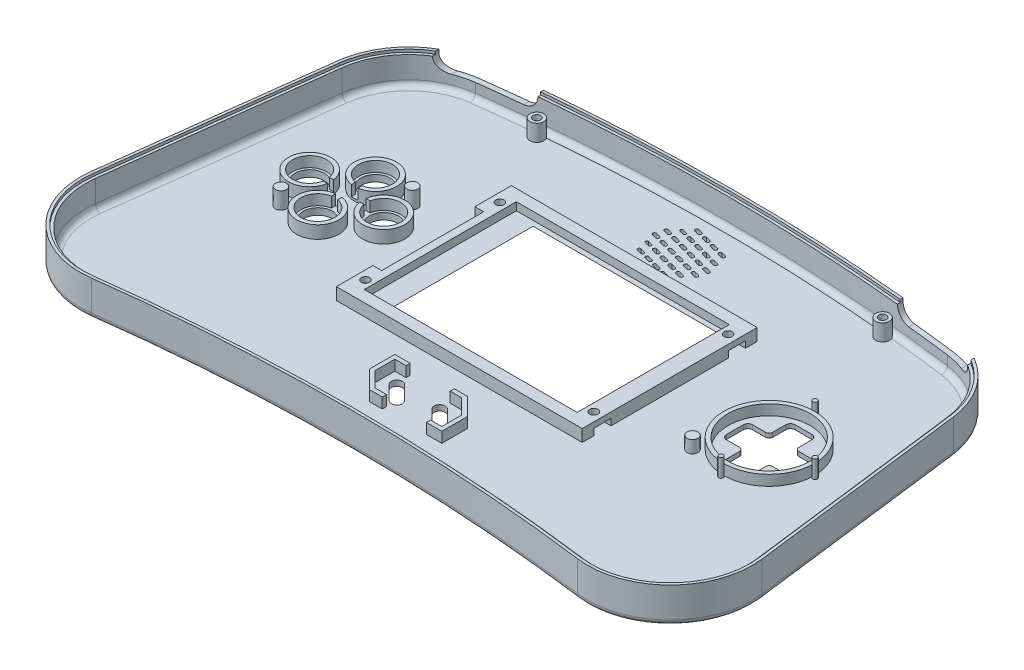
from build123d import *

# Parameters (mm, degrees)
FOND_COQUE_DEPTH                  = 2
CONTOUR_COQUE_DEPTH               = 10
CONG_1_R                          = 2
CONG_2_R                          = 2
ESQUISSE_CAVIT_CROU_W             = 67.82
ESQUISSE_CAVIT_CROU_H             = 51.74
CAVIT_CRAN_DEPTH                  = 3.55
ESQUISSE_GLISSI_RES_CRAN_W        = 67.82
ESQUISSE_GLISSI_RES_CRAN_H        = 51.74
GLISSI_RES_CRAN_DEPTH             = 1.55
CHANFREIN_CRAN_SIZE               = 3.55
ESQUISSE_SUR_L_VATION_CRAN_W      = 77.56
ESQUISSE_SUR_L_VATION_CRAN_H      = 55.4
SUR_L_VATION_CRAN_DEPTH           = 0.8
ESQUISSE_SUPPORT_CRAN_R           = 1.5
ESQUISSE_SUPPORT_CRAN_W           = 77.56
ESQUISSE_SUPPORT_CRAN_H           = 55.4
SUPPORT_CRAN_DEPTH                = 2.05
ESQUISSE_CAVIT_S_ABXY_R           = 5.3
CAVIT_S_ABXY_DEPTH                = 2.05
ESQUISSE_ABAISSEMENT_ABXY_R       = 5.3
ENL_V_MAT_EXTRU_4_DEPTH           = 0.4
ESQUISSE_SUPPORT_ABXY_R           = 7.7
ESQUISSE_SUPPORT_ABXY_R_2         = 6.2
SUPPORT_ABXY_DEPTH                = 4.6
BLOQUAGE_ABXY_DEPTH               = 4.6
ESQUISSE_FIXATION_MEMBRANE_ABXY_R = 2
FIXATION_MEMBRANE_ABXY_DEPTH      = 6.1
ESQUISSE37_R                      = 7.7
ESQUISSE37_R_2                    = 5.3
BOSS_EXTRU_4_DEPTH                = 0.8
CAVIT_DPAD_DEPTH                  = 2.05
ESQUISSE_SUPPORT_DPAD_R           = 16.5
ESQUISSE_SUPPORT_DPAD_R_2         = 15
SUPPORT_DPAD_DEPTH                = 3.8
ESQUISSE19_R                      = 16
ABAISSEMENT_DPAD_DEPTH            = 0.4
ESQUISSE25_R                      = 2
FIXATION_MEMBRANE_DPAD_DEPTH      = 4.5
ESQUISSE26_R                      = 0.825
BLOQUAGE_MEMBRANE_DPAD_DEPTH      = 6.5
BLOQUAGE_MEMBRANE_DPAD_2_DEPTH    = 6.5
BLOQUAGE_MEMBRANE_DPAD_3_DEPTH    = 6.5
BOSS_EXTRU_1_DEPTH                = 3.8
ENL_V_MAT_EXTRU_1_DEPTH           = 2
ENL_V_MAT_EXTRU_2_DEPTH           = 12.5
ESQUISSE31_R                      = 2.5
ESQUISSE31_R_2                    = 1.4
BOSS_EXTRU_2_DEPTH                = 6.04
ENL_V_MAT_EXTRU_3_DEPTH           = 2
BOSS_EXTRU_3_DEPTH                = 1


with BuildPart() as part:
    # Esquisse fond coque → Fond coque (new body)
    with BuildSketch(Plane(origin=(0, 0, 0), x_dir=(1, 0, 0), z_dir=(0, 1, 0))):
        with BuildLine():
            Line((-122.267092617, -38.917464466), (-112.267092617, 40.866153364))
            ThreePointArc((-112.267092617, 40.866153364), (-103.730176239, 58.331392363), (-86.278625954, 66.896257055))
            ThreePointArc((-86.278625954, 66.896257055), (0, 72.351557493), (86.278625954, 66.896257055))
            ThreePointArc((86.278625954, 66.896257055), (103.730176239, 58.331392363), (112.267092617, 40.866153364))
            Line((112.267092617, 40.866153364), (122.267092617, -38.917464466))
            ThreePointArc((122.267092617, -38.917464466), (113.659620701, -63.915093672), (88.618881119, -72.396331781))
            ThreePointArc((88.618881119, -72.396331781), (0, -66.639803527), (-88.618881119, -72.396331781))
            ThreePointArc((-88.618881119, -72.396331781), (-113.659620701, -63.915093672), (-122.267092617, -38.917464466))
        make_face()
    extrude(amount=FOND_COQUE_DEPTH)

    # Esquisse contour coque → Contour coque (add)
    with BuildSketch(Plane(origin=(0, 2, 0), x_dir=(1, 0, 0), z_dir=(0, 1, 0))):
        with BuildLine():
            Line((-122.267092617, -38.917464466), (-112.267092617, 40.866153364))
            ThreePointArc((-112.267092617, 40.866153364), (-103.730176239, 58.331392363), (-86.278625954, 66.896257055))
            ThreePointArc((-86.278625954, 66.896257055), (0, 72.351557493), (86.278625954, 66.896257055))
            ThreePointArc((86.278625954, 66.896257055), (103.730176239, 58.331392363), (112.267092617, 40.866153364))
            Line((112.267092617, 40.866153364), (122.267092617, -38.917464466))
            ThreePointArc((122.267092617, -38.917464466), (113.659620701, -63.915093672), (88.618881119, -72.396331781))
            ThreePointArc((88.618881119, -72.396331781), (0, -66.639803527), (-88.618881119, -72.396331781))
            ThreePointArc((-88.618881119, -72.396331781), (-113.659620701, -63.915093672), (-122.267092617, -38.917464466))
        make_face()
        with BuildLine():
            Line((-120.282619776, -39.166196336), (-110.282619776, 40.617421494))
            ThreePointArc((-110.282619776, 40.617421494), (-102.314831157, 56.918311227), (-86.026717557, 64.91218494))
            ThreePointArc((-86.026717557, 64.91218494), (0, 70.351557493), (86.026717557, 64.91218494))
            ThreePointArc((86.026717557, 64.91218494), (102.314831157, 56.918311227), (110.282619776, 40.617421494))
            Line((110.282619776, 40.617421494), (120.282619776, -39.166196336))
            ThreePointArc((120.282619776, -39.166196336), (112.248979321, -62.497316928), (88.877622378, -70.413139163))
            ThreePointArc((88.877622378, -70.413139163), (0, -64.639803527), (-88.877622378, -70.413139163))
            ThreePointArc((-88.877622378, -70.413139163), (-112.248979321, -62.497316928), (-120.282619776, -39.166196336))
        make_face(mode=Mode.SUBTRACT)
    extrude(amount=CONTOUR_COQUE_DEPTH)

    # Congé1
    cong_1_edges = [part.edges().sort_by_distance(p)[0] for p in [
        (-115.282619776, 2, -0.725612579),
        (-112.248979321, 2, 62.497316928),
        (0, 2, 64.639803527),
        (112.248979321, 2, 62.497316928),
        (115.282619776, 2, -0.725612579),
        (102.314831157, 2, -56.918311227),
        (0, 2, -70.351557493),
        (-102.314831157, 2, -56.918311227),
    ]]
    fillet(cong_1_edges, radius=CONG_1_R)

    # Congé2
    cong_2_edges = [part.edges().sort_by_distance(p)[0] for p in [
        (0, 0, 66.639803527),
        (-113.659620701, 0, 63.915093672),
        (-117.267092617, 0, -0.974344449),
        (-103.730176239, 0, -58.331392363),
        (0, 0, -72.351557493),
        (103.730176239, 0, -58.331392363),
        (117.267092617, 0, -0.974344449),
        (113.659620701, 0, 63.915093672),
    ]]
    fillet(cong_2_edges, radius=CONG_2_R)

    # Esquisse cavité écrou → Cavité écran (cut)
    with BuildSketch(Plane.XZ):
        with Locations((0, -8)):
            Rectangle(ESQUISSE_CAVIT_CROU_W, ESQUISSE_CAVIT_CROU_H)
    extrude(amount=-CAVIT_CRAN_DEPTH, mode=Mode.SUBTRACT)

    # Esquisse glissières écran → Glissières écran (add)
    with BuildSketch(Plane(origin=(0, 2, 0), x_dir=(1, 0, 0), z_dir=(0, 1, 0))):
        Polygon((-47.84, -23.87), (41.72, -23.87), (41.72, -19.58), (38.52, -19.58), (35.835321248, -18.03), (35.835321248, -14.93), (38.52, -13.38), (41.72, -13.38), (41.72, 29.38), (38.52, 29.38), (35.835321248, 30.93), (35.835321248, 34.03), (38.52, 35.58), (41.72, 35.58), (41.72, 39.87), (-47.84, 39.87), (-47.84, 35.58), (-44.64, 35.58), (-41.955321248, 34.03), (-41.955321248, 30.93), (-44.64, 29.38), (-47.84, 29.38), (-47.84, 26.555), (-44.64, 26.555), (-44.64, -10.555), (-47.84, -10.555), (-47.84, -13.38), (-44.64, -13.38), (-41.955321248, -14.93), (-41.955321248, -18.03), (-44.64, -19.58), (-47.84, -19.58), align=None)
        with Locations((0, 8)):
            Rectangle(ESQUISSE_GLISSI_RES_CRAN_W, ESQUISSE_GLISSI_RES_CRAN_H, mode=Mode.SUBTRACT)
    extrude(amount=GLISSI_RES_CRAN_DEPTH)

    # Chanfrein écran
    chanfrein_cran_edges = [part.edges().sort_by_distance(p)[0] for p in [
        (33.91, 0, -8),
        (0, 0, 17.87),
        (-33.91, 0, -8),
        (0, 0, -33.87),
    ]]
    chamfer(chanfrein_cran_edges, length=CHANFREIN_CRAN_SIZE - 0.0001)  # a hair under: the kernel refuses the full size

    # Esquisse surélévation écran → Surélévation écran (add)
    with BuildSketch(Plane(origin=(0, 3.55, 0), x_dir=(1, 0, 0), z_dir=(0, 1, 0))):
        Polygon((-47.84, 39.87), (-47.84, 35.58), (-44.64, 35.58), (-41.955321248, 34.03), (-41.955321248, 30.93), (-44.64, 29.38), (-47.84, 29.38), (-47.84, 26.555), (-44.64, 26.555), (-44.64, -10.555), (-47.84, -10.555), (-47.84, -13.38), (-44.64, -13.38), (-41.955321248, -14.93), (-41.955321248, -18.03), (-44.64, -19.58), (-47.84, -19.58), (-47.84, -23.87), (41.72, -23.87), (41.72, -19.58), (38.52, -19.58), (35.835321248, -18.03), (35.835321248, -14.93), (38.52, -13.38), (41.72, -13.38), (41.72, 29.38), (38.52, 29.38), (35.835321248, 30.93), (35.835321248, 34.03), (38.52, 35.58), (41.72, 35.58), (41.72, 39.87), align=None)
        with Locations((-3.06, 8)):
            Rectangle(ESQUISSE_SUR_L_VATION_CRAN_W, ESQUISSE_SUR_L_VATION_CRAN_H, mode=Mode.SUBTRACT)
    extrude(amount=SUR_L_VATION_CRAN_DEPTH)

    # Esquisse support écran → Support écran (add)
    with BuildSketch(Plane(origin=(0, 4.35, 0), x_dir=(1, 0, 0), z_dir=(0, 1, 0))):
        Polygon((-47.84, -10.555), (-47.84, -23.87), (41.72, -23.87), (41.72, 39.87), (-47.84, 39.87), (-47.84, 26.555), (-44.64, 26.555), (-44.64, -10.555), align=None)
        with Locations(Location((-44.64, 32.48, 0), (0, 0, 270))):
            Circle(ESQUISSE_SUPPORT_CRAN_R, mode=Mode.SUBTRACT)
        with Locations(Location((-44.64, -16.48, 0), (0, 0, 270))):
            Circle(ESQUISSE_SUPPORT_CRAN_R, mode=Mode.SUBTRACT)
        with Locations(Location((38.52, -16.48, 0), (0, 0, 270))):
            Circle(ESQUISSE_SUPPORT_CRAN_R, mode=Mode.SUBTRACT)
        with Locations(Location((38.52, 32.48, 0), (0, 0, 270))):
            Circle(ESQUISSE_SUPPORT_CRAN_R, mode=Mode.SUBTRACT)
        with Locations((-3.06, 8)):
            Rectangle(ESQUISSE_SUPPORT_CRAN_W, ESQUISSE_SUPPORT_CRAN_H, mode=Mode.SUBTRACT)
    extrude(amount=SUPPORT_CRAN_DEPTH)

    # Esquisse cavités ABXY → Cavités ABXY (cut)
    with BuildSketch(Plane.XZ):
        with Locations(Location((-75.96, -18.5, 0), (0, 0, 270))):
            Circle(ESQUISSE_CAVIT_S_ABXY_R)
        with Locations(Location((-75.96, 2.5, 0), (0, 0, 270))):
            Circle(ESQUISSE_CAVIT_S_ABXY_R)
        with Locations(Location((-62.46, -8, 0), (0, 0, 270))):
            Circle(ESQUISSE_CAVIT_S_ABXY_R)
        with Locations(Location((-89.46, -8, 0), (0, 0, 270))):
            Circle(ESQUISSE_CAVIT_S_ABXY_R)
    extrude(amount=-CAVIT_S_ABXY_DEPTH, mode=Mode.SUBTRACT)

    # Esquisse abaissement ABXY → Enlèv. mat.-Extru.4 (cut)
    # profile 1 of 2: a face of its own
    with BuildSketch(Plane(origin=(0, 0, 0), x_dir=(-1, 0, 0), z_dir=(0, -1, 0))):
        with BuildLine():
            Line((79.910107836, 13.337705802), (66.49112014, 2.900715372))
            ThreePointArc((66.49112014, 2.900715372), (57.369716739, 4.040890797), (58.509892164, 13.162294198))
            Line((58.509892164, 13.162294198), (71.92887986, 23.599284628))
            ThreePointArc((71.92887986, 23.599284628), (81.050283261, 22.459109203), (79.910107836, 13.337705802))
        make_face()
        with Locations(Location((62.46, 8, 0), (0, 0, 90))):
            Circle(ESQUISSE_ABAISSEMENT_ABXY_R, mode=Mode.SUBTRACT)
        with Locations(Location((75.96, 18.5, 0), (0, 0, 90))):
            Circle(ESQUISSE_ABAISSEMENT_ABXY_R, mode=Mode.SUBTRACT)
    # profile 2 of 2: a face of its own
    with BuildSketch(Plane(origin=(0, 0, 0), x_dir=(-1, 0, 0), z_dir=(0, -1, 0))):
        with BuildLine():
            Line((72.009892164, 2.662294198), (85.42887986, 13.099284628))
            ThreePointArc((85.42887986, 13.099284628), (94.550283261, 11.959109203), (93.410107836, 2.837705802))
            Line((93.410107836, 2.837705802), (79.99112014, -7.599284628))
            ThreePointArc((79.99112014, -7.599284628), (70.869716739, -6.459109203), (72.009892164, 2.662294198))
        make_face()
        with Locations(Location((75.96, -2.5, 0), (0, 0, 90))):
            Circle(ESQUISSE_ABAISSEMENT_ABXY_R, mode=Mode.SUBTRACT)
        with Locations(Location((89.46, 8, 0), (0, 0, 90))):
            Circle(ESQUISSE_ABAISSEMENT_ABXY_R, mode=Mode.SUBTRACT)
    extrude(amount=-ENL_V_MAT_EXTRU_4_DEPTH, mode=Mode.SUBTRACT)

    # Esquisse support ABXY → Support ABXY (add)
    # profile 1 of 4: a face of its own
    with BuildSketch(Plane(origin=(0, 2, 0), x_dir=(1, 0, 0), z_dir=(0, 1, 0))):
        with Locations(Location((-75.96, 18.5, 0), (0, 0, 270))):
            Circle(ESQUISSE_SUPPORT_ABXY_R)
        with Locations(Location((-75.96, 18.5, 0), (0, 0, 270))):
            Circle(ESQUISSE_SUPPORT_ABXY_R_2, mode=Mode.SUBTRACT)
    # profile 2 of 4: a face of its own
    with BuildSketch(Plane(origin=(0, 2, 0), x_dir=(1, 0, 0), z_dir=(0, 1, 0))):
        with Locations(Location((-89.46, 8, 0), (0, 0, 270))):
            Circle(ESQUISSE_SUPPORT_ABXY_R)
        with Locations(Location((-89.46, 8, 0), (0, 0, 270))):
            Circle(ESQUISSE_SUPPORT_ABXY_R_2, mode=Mode.SUBTRACT)
    # profile 3 of 4: a face of its own
    with BuildSketch(Plane(origin=(0, 2, 0), x_dir=(1, 0, 0), z_dir=(0, 1, 0))):
        with Locations(Location((-75.96, -2.5, 0), (0, 0, 270))):
            Circle(ESQUISSE_SUPPORT_ABXY_R)
        with Locations(Location((-75.96, -2.5, 0), (0, 0, 270))):
            Circle(ESQUISSE_SUPPORT_ABXY_R_2, mode=Mode.SUBTRACT)
    # profile 4 of 4: a face of its own
    with BuildSketch(Plane(origin=(0, 2, 0), x_dir=(1, 0, 0), z_dir=(0, 1, 0))):
        with Locations(Location((-62.46, 8, 0), (0, 0, 270))):
            Circle(ESQUISSE_SUPPORT_ABXY_R)
        with Locations(Location((-62.46, 8, 0), (0, 0, 270))):
            Circle(ESQUISSE_SUPPORT_ABXY_R_2, mode=Mode.SUBTRACT)
    extrude(amount=SUPPORT_ABXY_DEPTH)

    # Esquisse bloquage ABXY → Bloquage ABXY (cut)
    with BuildSketch(Plane(origin=(0, 2, 0), x_dir=(1, 0, 0), z_dir=(0, 1, 0))):
        Polygon((-74.81, 3), (-77.11, 3), (-77.11, 6.85), (-83.96, 6.85), (-83.96, 9.15), (-77.11, 9.15), (-77.11, 13), (-74.81, 13), (-74.81, 9.15), (-67.96, 9.15), (-67.96, 6.85), (-74.81, 6.85), align=None)
    extrude(amount=BLOQUAGE_ABXY_DEPTH, mode=Mode.SUBTRACT)

    # Esquisse fixation membrane ABXY → Fixation membrane ABXY (add)
    with BuildSketch(Plane(origin=(0, 2, 0), x_dir=(1, 0, 0), z_dir=(0, 1, 0))):
        with Locations(Location((-87.849022885, -4.052815137, 0), (0, 0, 270))):
            Circle(ESQUISSE_FIXATION_MEMBRANE_ABXY_R)
        with Locations(Location((-64.070977115, 20.052815137, 0), (0, 0, 270))):
            Circle(ESQUISSE_FIXATION_MEMBRANE_ABXY_R)
    extrude(amount=FIXATION_MEMBRANE_ABXY_DEPTH)

    # Esquisse37 → Boss.-Extru.4 (add)
    # profile 1 of 4: a face of its own
    with BuildSketch(Plane(origin=(0, 2, 0), x_dir=(1, 0, 0), z_dir=(0, 1, 0))):
        with Locations(Location((-89.46, 8, 0), (0, 0, 8.589297624))):
            Circle(ESQUISSE37_R)
        with Locations(Location((-89.46, 8, 0), (0, 0, 90))):
            Circle(ESQUISSE37_R_2, mode=Mode.SUBTRACT)
    # profile 2 of 4: a face of its own
    with BuildSketch(Plane(origin=(0, 2, 0), x_dir=(1, 0, 0), z_dir=(0, 1, 0))):
        with Locations(Location((-75.96, 18.5, 0), (0, 0, 261.410702376))):
            Circle(ESQUISSE37_R)
        with Locations(Location((-75.96, 18.5, 0), (0, 0, 90))):
            Circle(ESQUISSE37_R_2, mode=Mode.SUBTRACT)
    # profile 3 of 4: a face of its own
    with BuildSketch(Plane(origin=(0, 2, 0), x_dir=(1, 0, 0), z_dir=(0, 1, 0))):
        with Locations(Location((-62.46, 8, 0), (0, 0, 171.410702376))):
            Circle(ESQUISSE37_R)
        with Locations(Location((-62.46, 8, 0), (0, 0, 90))):
            Circle(ESQUISSE37_R_2, mode=Mode.SUBTRACT)
    # profile 4 of 4: a face of its own
    with BuildSketch(Plane(origin=(0, 2, 0), x_dir=(1, 0, 0), z_dir=(0, 1, 0))):
        with Locations(Location((-75.96, -2.5, 0), (0, 0, 81.410702376))):
            Circle(ESQUISSE37_R)
        with Locations(Location((-75.96, -2.5, 0), (0, 0, 90))):
            Circle(ESQUISSE37_R_2, mode=Mode.SUBTRACT)
    extrude(amount=BOSS_EXTRU_4_DEPTH)

    # Esquisse cavité DPad → Cavité DPad (cut)
    with BuildSketch(Plane.XZ):
        with BuildLine():
            Line((82.71, -14.035533906), (82.71, -18.815863992))
            ThreePointArc((82.71, -18.815863992), (82.216727984, -20.006727984), (81.025863992, -20.5))
            Line((81.025863992, -20.5), (74.894136008, -20.5))
            ThreePointArc((74.894136008, -20.5), (73.703272016, -20.006727984), (73.21, -18.815863992))
            Line((73.21, -18.815863992), (73.21, -14.035533906))
            ThreePointArc((73.21, -14.035533906), (72.833475836, -13.126524164), (71.924466094, -12.75))
            Line((71.924466094, -12.75), (67.144136008, -12.75))
            ThreePointArc((67.144136008, -12.75), (65.953272016, -12.256727984), (65.46, -11.065863992))
            Line((65.46, -11.065863992), (65.46, -4.934136008))
            ThreePointArc((65.46, -4.934136008), (65.953272016, -3.743272016), (67.144136008, -3.25))
            Line((67.144136008, -3.25), (71.924466094, -3.25))
            ThreePointArc((71.924466094, -3.25), (72.833475836, -2.873475836), (73.21, -1.964466094))
            Line((73.21, -1.964466094), (73.21, 2.815863992))
            ThreePointArc((73.21, 2.815863992), (73.703272016, 4.006727984), (74.894136008, 4.5))
            Line((74.894136008, 4.5), (81.025863992, 4.5))
            ThreePointArc((81.025863992, 4.5), (82.216727984, 4.006727984), (82.71, 2.815863992))
            Line((82.71, 2.815863992), (82.71, -1.964466094))
            ThreePointArc((82.71, -1.964466094), (83.086524164, -2.873475836), (83.995533906, -3.25))
            Line((83.995533906, -3.25), (88.775863992, -3.25))
            ThreePointArc((88.775863992, -3.25), (89.966727984, -3.743272016), (90.46, -4.934136008))
            Line((90.46, -4.934136008), (90.46, -11.065863992))
            ThreePointArc((90.46, -11.065863992), (89.966727984, -12.256727984), (88.775863992, -12.75))
            Line((88.775863992, -12.75), (83.995533906, -12.75))
            ThreePointArc((83.995533906, -12.75), (83.086524164, -13.126524164), (82.71, -14.035533906))
        make_face()
    extrude(amount=-CAVIT_DPAD_DEPTH, mode=Mode.SUBTRACT)

    # Esquisse support DPad → Support DPad (add)
    with BuildSketch(Plane(origin=(0, 2, 0), x_dir=(1, 0, 0), z_dir=(0, 1, 0))):
        with Locations(Location((77.96, 8, 0), (0, 0, 90))):
            Circle(ESQUISSE_SUPPORT_DPAD_R)
        with Locations(Location((77.96, 8, 0), (0, 0, 90))):
            Circle(ESQUISSE_SUPPORT_DPAD_R_2, mode=Mode.SUBTRACT)
    extrude(amount=SUPPORT_DPAD_DEPTH)

    # Esquisse19 → Abaissement DPad (cut)
    with BuildSketch(Plane.XZ):
        with Locations(Location((77.96, -8, 0), (0, 0, 270))):
            Circle(ESQUISSE19_R)
    extrude(amount=-ABAISSEMENT_DPAD_DEPTH, mode=Mode.SUBTRACT)

    # Esquisse25 → Fixation membrane DPad (add)
    with BuildSketch(Plane(origin=(0, 2, 0), x_dir=(1, 0, 0), z_dir=(0, 1, 0))):
        with Locations(Location((63.994641072, -5.965358928, 0), (0, 0, 270))):
            Circle(ESQUISSE25_R)
    extrude(amount=FIXATION_MEMBRANE_DPAD_DEPTH)

    # Esquisse27 → Boss.-Extru.1 (add)
    with BuildSketch(Plane(origin=(0, 2, 0), x_dir=(1, 0, 0), z_dir=(0, 1, 0))):
        Polygon((-10.8, -34.02), (-10.8, -35.52), (-14.9, -35.52), (-14.9, -42.704567107), (-9.384567107, -48.22), (-5.284567107, -48.22), (-5.284567107, -49.72), (-10.00588745, -49.72), (-16.4, -43.32588745), (-16.4, -34.02), align=None)
        Polygon((5.284567107, -34.02), (5.284567107, -35.52), (9.384567107, -35.52), (14.9, -41.035432893), (14.9, -48.22), (10.8, -48.22), (10.8, -49.72), (16.4, -49.72), (16.4, -40.41411255), (10.00588745, -34.02), align=None)
    extrude(amount=BOSS_EXTRU_1_DEPTH)

    # Esquisse28 → Enlèv. mat.-Extru.1 (cut)
    with BuildSketch(Plane(origin=(0, 2, 0), x_dir=(1, 0, 0), z_dir=(0, 1, 0))):
        with BuildLine():
            Line((-8.92137085, -37.910202025), (-3.830202025, -43.00137085))
            ThreePointArc((-3.830202025, -43.00137085), (-3.830202025, -45.829797975), (-6.65862915, -45.829797975))
            Line((-6.65862915, -45.829797975), (-11.749797975, -40.73862915))
            ThreePointArc((-11.749797975, -40.73862915), (-11.749797975, -37.910202025), (-8.92137085, -37.910202025))
        make_face()
        with BuildLine():
            Line((6.65862915, -37.910202025), (11.749797975, -43.00137085))
            ThreePointArc((11.749797975, -43.00137085), (11.749797975, -45.829797975), (8.92137085, -45.829797975))
            Line((8.92137085, -45.829797975), (3.830202025, -40.73862915))
            ThreePointArc((3.830202025, -40.73862915), (3.830202025, -37.910202025), (6.65862915, -37.910202025))
        make_face()
    extrude(amount=-ENL_V_MAT_EXTRU_1_DEPTH, mode=Mode.SUBTRACT)

    # Esquisse30 → Enlèv. mat.-Extru.2 (cut, symmetric)
    with BuildSketch(Plane(origin=(0, 0, -70.849932586), x_dir=(-1, 0, 0), z_dir=(0, 0, -1))):
        with BuildLine():
            Line((-92.85, 7.35), (-70.15, 7.35))
            ThreePointArc((-70.15, 7.35), (-66.861953467, 8.711953467), (-65.5, 12))
            Line((-65.5, 12), (-97.5, 12))
            ThreePointArc((-97.5, 12), (-96.138046533, 8.711953467), (-92.85, 7.35))
        make_face()
        with BuildLine():
            Line((97.5, 12), (65.5, 12))
            ThreePointArc((65.5, 12), (66.861953467, 8.711953467), (70.15, 7.35))
            Line((70.15, 7.35), (92.85, 7.35))
            ThreePointArc((92.85, 7.35), (96.138046533, 8.711953467), (97.5, 12))
        make_face()
    extrude(amount=ENL_V_MAT_EXTRU_2_DEPTH, both=True, mode=Mode.SUBTRACT)

    # Esquisse31 → Boss.-Extru.2 (add)
    # profile 1 of 2: a face of its own
    with BuildSketch(Plane(origin=(0, 2, 0), x_dir=(1, 0, 0), z_dir=(0, 1, 0))):
        with Locations(Location((-62.98, 64.303563447, 0), (0, 0, 31.955716634))):
            Circle(ESQUISSE31_R)
        with Locations(Location((-62.98, 64.303563447, 0), (0, 0, 58.728166447))):
            Circle(ESQUISSE31_R_2, mode=Mode.SUBTRACT)
    # profile 2 of 2: a face of its own
    with BuildSketch(Plane(origin=(0, 2, 0), x_dir=(1, 0, 0), z_dir=(0, 1, 0))):
        with Locations(Location((62.98, 64.303563447, 0), (0, 0, 148.04428335))):
            Circle(ESQUISSE31_R)
        with Locations(Location((62.98, 64.303563447, 0), (0, 0, 121.271833558))):
            Circle(ESQUISSE31_R_2, mode=Mode.SUBTRACT)
    extrude(amount=BOSS_EXTRU_2_DEPTH)

    # Esquisse34 → Enlèv. mat.-Extru.3 (cut)
    with BuildSketch(Plane.XZ):
        with BuildLine():
            Line((8.942036004, -61.018950214), (7.396554682, -61.433060687))
            ThreePointArc((7.396554682, -61.433060687), (6.661707759, -61.008796618), (7.085971828, -60.273949695))
            Line((7.085971828, -60.273949695), (8.63145315, -59.859839223))
            ThreePointArc((8.63145315, -59.859839223), (9.366300073, -60.284103292), (8.942036004, -61.018950214))
        make_face()
        with BuildLine():
            Line((5.078332699, -62.054226395), (3.532851377, -62.468336867))
            ThreePointArc((3.532851377, -62.468336867), (2.798004454, -62.044072798), (3.222268523, -61.309225875))
            Line((3.222268523, -61.309225875), (4.767749845, -60.895115403))
            ThreePointArc((4.767749845, -60.895115403), (5.502596767, -61.319379472), (5.078332699, -62.054226395))
        make_face()
        with BuildLine():
            Line((1.214629394, -63.089502575), (-0.330851929, -63.503613047))
            ThreePointArc((-0.330851929, -63.503613047), (-1.065698851, -63.079348979), (-0.641434783, -62.344502056))
            Line((-0.641434783, -62.344502056), (0.904046539, -61.930391584))
            ThreePointArc((0.904046539, -61.930391584), (1.638893462, -62.354655652), (1.214629394, -63.089502575))
        make_face()
        with BuildLine():
            Line((-2.649073912, -64.124778756), (-4.194555234, -64.538889228))
            ThreePointArc((-4.194555234, -64.538889228), (-4.929402157, -64.114625159), (-4.505138088, -63.379778236))
            Line((-4.505138088, -63.379778236), (-2.959656766, -62.965667764))
            ThreePointArc((-2.959656766, -62.965667764), (-2.224809843, -63.389931833), (-2.649073912, -64.124778756))
        make_face()
        with BuildLine():
            Line((9.986508073, -57.189566434), (8.441026751, -57.603676906))
            ThreePointArc((8.441026751, -57.603676906), (7.706179828, -57.179412838), (8.130443897, -56.444565915))
            Line((8.130443897, -56.444565915), (9.675925219, -56.030455443))
            ThreePointArc((9.675925219, -56.030455443), (10.410772142, -56.454719511), (9.986508073, -57.189566434))
        make_face()
        with BuildLine():
            Line((6.122804768, -58.224842614), (4.577323446, -58.638953087))
            ThreePointArc((4.577323446, -58.638953087), (3.842476523, -58.214689018), (4.266740592, -57.479842095))
            Line((4.266740592, -57.479842095), (5.812221914, -57.065731623))
            ThreePointArc((5.812221914, -57.065731623), (6.547068837, -57.489995692), (6.122804768, -58.224842614))
        make_face()
        with BuildLine():
            Line((2.259101463, -59.260118795), (0.713620141, -59.674229267))
            ThreePointArc((0.713620141, -59.674229267), (-0.021226782, -59.249965198), (0.403037287, -58.515118276))
            Line((0.403037287, -58.515118276), (1.948518609, -58.101007803))
            ThreePointArc((1.948518609, -58.101007803), (2.683365532, -58.525271872), (2.259101463, -59.260118795))
        make_face()
        with BuildLine():
            Line((-1.604601842, -60.295394975), (-3.150083164, -60.709505447))
            ThreePointArc((-3.150083164, -60.709505447), (-3.884930087, -60.285241379), (-3.460666018, -59.550394456))
            Line((-3.460666018, -59.550394456), (-1.915184696, -59.136283984))
            ThreePointArc((-1.915184696, -59.136283984), (-1.180337774, -59.560548052), (-1.604601842, -60.295394975))
        make_face()
        with BuildLine():
            Line((-5.397594469, -61.208196669), (-6.943075791, -61.622307141))
            ThreePointArc((-6.943075791, -61.622307141), (-7.555448227, -61.26875375), (-7.201894836, -60.656381314))
            Line((-7.201894836, -60.656381314), (-5.656413514, -60.242270842))
            ThreePointArc((-5.656413514, -60.242270842), (-5.044041079, -60.595824233), (-5.397594469, -61.208196669))
        make_face()
        with BuildLine():
            Line((11.030980143, -53.360182654), (9.485498821, -53.774293126))
            ThreePointArc((9.485498821, -53.774293126), (8.750651898, -53.350029057), (9.174915966, -52.615182134))
            Line((9.174915966, -52.615182134), (10.720397288, -52.201071662))
            ThreePointArc((10.720397288, -52.201071662), (11.455244211, -52.625335731), (11.030980143, -53.360182654))
        make_face()
        with BuildLine():
            Line((7.167276837, -54.395458834), (5.621795515, -54.809569306))
            ThreePointArc((5.621795515, -54.809569306), (4.886948593, -54.385305238), (5.311212661, -53.650458315))
            Line((5.311212661, -53.650458315), (6.856693983, -53.236347843))
            ThreePointArc((6.856693983, -53.236347843), (7.591540906, -53.660611911), (7.167276837, -54.395458834))
        make_face()
        with BuildLine():
            Line((3.303573532, -55.430735015), (1.75809221, -55.844845487))
            ThreePointArc((1.75809221, -55.844845487), (1.023245287, -55.420581418), (1.447509356, -54.685734495))
            Line((1.447509356, -54.685734495), (2.992990678, -54.271624023))
            ThreePointArc((2.992990678, -54.271624023), (3.727837601, -54.695888092), (3.303573532, -55.430735015))
        make_face()
        with BuildLine():
            Line((-0.560129773, -56.466011195), (-2.105611095, -56.880121667))
            ThreePointArc((-2.105611095, -56.880121667), (-2.840458018, -56.455857598), (-2.416193949, -55.721010676))
            Line((-2.416193949, -55.721010676), (-0.870712627, -55.306900203))
            ThreePointArc((-0.870712627, -55.306900203), (-0.135865704, -55.731164272), (-0.560129773, -56.466011195))
        make_face()
        with BuildLine():
            Line((-4.423833078, -57.501287375), (-5.9693144, -57.915397848))
            ThreePointArc((-5.9693144, -57.915397848), (-6.704161323, -57.491133779), (-6.279897254, -56.756286856))
            Line((-6.279897254, -56.756286856), (-4.734415932, -56.342176384))
            ThreePointArc((-4.734415932, -56.342176384), (-3.999569009, -56.766440453), (-4.423833078, -57.501287375))
        make_face()
        with BuildLine():
            Line((-8.287536383, -58.536563556), (-9.833017705, -58.950674028))
            ThreePointArc((-9.833017705, -58.950674028), (-10.567864628, -58.526409959), (-10.143600559, -57.791563036))
            Line((-10.143600559, -57.791563036), (-8.598119237, -57.377452564))
            ThreePointArc((-8.598119237, -57.377452564), (-7.863272314, -57.801716633), (-8.287536383, -58.536563556))
        make_face()
        with BuildLine():
            Line((10.143600559, -50.048436964), (8.598119237, -50.462547436))
            ThreePointArc((8.598119237, -50.462547436), (7.863272314, -50.038283367), (8.287536383, -49.303436444))
            Line((8.287536383, -49.303436444), (9.833017705, -48.889325972))
            ThreePointArc((9.833017705, -48.889325972), (10.567864628, -49.313590041), (10.143600559, -50.048436964))
        make_face()
        with BuildLine():
            Line((6.279897254, -51.083713144), (4.734415932, -51.497823616))
            ThreePointArc((4.734415932, -51.497823616), (3.999569009, -51.073559547), (4.423833078, -50.338712625))
            Line((4.423833078, -50.338712625), (5.9693144, -49.924602152))
            ThreePointArc((5.9693144, -49.924602152), (6.704161323, -50.348866221), (6.279897254, -51.083713144))
        make_face()
        with BuildLine():
            Line((2.416193949, -52.118989324), (0.870712627, -52.533099797))
            ThreePointArc((0.870712627, -52.533099797), (0.135865704, -52.108835728), (0.560129773, -51.373988805))
            Line((0.560129773, -51.373988805), (2.105611095, -50.959878333))
            ThreePointArc((2.105611095, -50.959878333), (2.840458018, -51.384142402), (2.416193949, -52.118989324))
        make_face()
        with BuildLine():
            Line((-1.447509356, -53.154265505), (-2.992990678, -53.568375977))
            ThreePointArc((-2.992990678, -53.568375977), (-3.727837601, -53.144111908), (-3.303573532, -52.409264985))
            Line((-3.303573532, -52.409264985), (-1.75809221, -51.995154513))
            ThreePointArc((-1.75809221, -51.995154513), (-1.023245287, -52.419418582), (-1.447509356, -53.154265505))
        make_face()
        with BuildLine():
            Line((-5.311212661, -54.189541685), (-6.856693983, -54.603652157))
            ThreePointArc((-6.856693983, -54.603652157), (-7.591540906, -54.179388089), (-7.167276837, -53.444541166))
            Line((-7.167276837, -53.444541166), (-5.621795515, -53.030430694))
            ThreePointArc((-5.621795515, -53.030430694), (-4.886948593, -53.454694762), (-5.311212661, -54.189541685))
        make_face()
        with BuildLine():
            Line((-9.174915966, -55.224817866), (-10.720397288, -55.638928338))
            ThreePointArc((-10.720397288, -55.638928338), (-11.455244211, -55.214664269), (-11.030980143, -54.479817346))
            Line((-11.030980143, -54.479817346), (-9.485498821, -54.065706874))
            ThreePointArc((-9.485498821, -54.065706874), (-8.750651898, -54.489970943), (-9.174915966, -55.224817866))
        make_face()
        with BuildLine():
            Line((7.324369324, -47.254329364), (5.778888002, -47.668439836))
            ThreePointArc((5.778888002, -47.668439836), (5.044041079, -47.244175767), (5.468305147, -46.509328844))
            Line((5.468305147, -46.509328844), (7.013786469, -46.095218372))
            ThreePointArc((7.013786469, -46.095218372), (7.748633392, -46.519482441), (7.324369324, -47.254329364))
        make_face()
        with BuildLine():
            Line((3.460666018, -48.289605544), (1.915184696, -48.703716016))
            ThreePointArc((1.915184696, -48.703716016), (1.180337774, -48.279451948), (1.604601842, -47.544605025))
            Line((1.604601842, -47.544605025), (3.150083164, -47.130494553))
            ThreePointArc((3.150083164, -47.130494553), (3.884930087, -47.554758621), (3.460666018, -48.289605544))
        make_face()
        with BuildLine():
            Line((-0.403037287, -49.324881724), (-1.948518609, -49.738992197))
            ThreePointArc((-1.948518609, -49.738992197), (-2.683365532, -49.314728128), (-2.259101463, -48.579881205))
            Line((-2.259101463, -48.579881205), (-0.713620141, -48.165770733))
            ThreePointArc((-0.713620141, -48.165770733), (0.021226782, -48.590034802), (-0.403037287, -49.324881724))
        make_face()
        with BuildLine():
            Line((-4.266740592, -50.360157905), (-5.812221914, -50.774268377))
            ThreePointArc((-5.812221914, -50.774268377), (-6.547068837, -50.350004308), (-6.122804768, -49.615157386))
            Line((-6.122804768, -49.615157386), (-4.577323446, -49.201046913))
            ThreePointArc((-4.577323446, -49.201046913), (-3.842476523, -49.625310982), (-4.266740592, -50.360157905))
        make_face()
        with BuildLine():
            Line((-8.059733219, -51.272959598), (-9.605214541, -51.68707007))
            ThreePointArc((-9.605214541, -51.68707007), (-10.217586977, -51.33351668), (-9.864033586, -50.721144244))
            Line((-9.864033586, -50.721144244), (-8.318552264, -50.307033772))
            ThreePointArc((-8.318552264, -50.307033772), (-7.706179828, -50.660587162), (-8.059733219, -51.272959598))
        make_face()
        with BuildLine():
            Line((4.505138088, -44.460221764), (2.959656766, -44.874332236))
            ThreePointArc((2.959656766, -44.874332236), (2.224809843, -44.450068167), (2.649073912, -43.715221244))
            Line((2.649073912, -43.715221244), (4.194555234, -43.301110772))
            ThreePointArc((4.194555234, -43.301110772), (4.929402157, -43.725374841), (4.505138088, -44.460221764))
        make_face()
        with BuildLine():
            Line((0.641434783, -45.495497944), (-0.904046539, -45.909608416))
            ThreePointArc((-0.904046539, -45.909608416), (-1.638893462, -45.485344348), (-1.214629394, -44.750497425))
            Line((-1.214629394, -44.750497425), (0.330851929, -44.336386953))
            ThreePointArc((0.330851929, -44.336386953), (1.065698851, -44.760651021), (0.641434783, -45.495497944))
        make_face()
        with BuildLine():
            Line((-3.222268523, -46.530774125), (-4.767749845, -46.944884597))
            ThreePointArc((-4.767749845, -46.944884597), (-5.502596767, -46.520620528), (-5.078332699, -45.785773605))
            Line((-5.078332699, -45.785773605), (-3.532851377, -45.371663133))
            ThreePointArc((-3.532851377, -45.371663133), (-2.798004454, -45.795927202), (-3.222268523, -46.530774125))
        make_face()
        with BuildLine():
            Line((-7.085971828, -47.566050305), (-8.63145315, -47.980160777))
            ThreePointArc((-8.63145315, -47.980160777), (-9.366300073, -47.555896708), (-8.942036004, -46.821049786))
            Line((-8.942036004, -46.821049786), (-7.396554682, -46.406939313))
            ThreePointArc((-7.396554682, -46.406939313), (-6.661707759, -46.831203382), (-7.085971828, -47.566050305))
        make_face()
    extrude(amount=-ENL_V_MAT_EXTRU_3_DEPTH, mode=Mode.SUBTRACT)

    # Esquisse35 → Boss.-Extru.3 (add)
    with BuildSketch(Plane(origin=(0, 12, 0), x_dir=(1, 0, 0), z_dir=(0, 1, 0))):
        with BuildLine():
            Line((-121.274856196, -39.041830401), (-111.274856196, 40.741787429))
            ThreePointArc((-111.274856196, 40.741787429), (-106.821894298, 52.929017722), (-97.5, 61.954522614))
            Line((-97.5, 61.954522614), (-97.5, 63.115937436))
            ThreePointArc((-97.5, 63.115937436), (-107.495726998, 53.724739266), (-112.267092617, 40.866153364))
            Line((-112.267092617, 40.866153364), (-122.267092617, -38.917464466))
            ThreePointArc((-122.267092617, -38.917464466), (-113.659620701, -63.915093672), (-88.618881119, -72.396331781))
            ThreePointArc((-88.618881119, -72.396331781), (0, -66.639803527), (88.618881119, -72.396331781))
            ThreePointArc((88.618881119, -72.396331781), (113.659620701, -63.915093672), (122.267092617, -38.917464466))
            Line((122.267092617, -38.917464466), (112.267092617, 40.866153364))
            ThreePointArc((112.267092617, 40.866153364), (107.495726998, 53.724739266), (97.5, 63.115937436))
            Line((97.5, 63.115937436), (97.5, 61.954522614))
            ThreePointArc((97.5, 61.954522614), (106.821894298, 52.929017722), (111.274856196, 40.741787429))
            Line((111.274856196, 40.741787429), (121.274856196, -39.041830401))
            ThreePointArc((121.274856196, -39.041830401), (112.954300011, -63.2062053), (88.748251748, -71.404735472))
            ThreePointArc((88.748251748, -71.404735472), (0, -65.639803527), (-88.748251748, -71.404735472))
            ThreePointArc((-88.748251748, -71.404735472), (-112.954300011, -63.2062053), (-121.274856196, -39.041830401))
        make_face()
        with BuildLine():
            Line((-65.5, 68.208180244), (-65.5, 69.212797042))
            ThreePointArc((-65.5, 69.212797042), (0, 72.351557493), (65.5, 69.212797042))
            Line((65.5, 69.212797042), (65.5, 68.208180244))
            ThreePointArc((65.5, 68.208180244), (0, 71.351550727), (-65.5, 68.208180244))
        make_face()
    extrude(amount=BOSS_EXTRU_3_DEPTH)


with BuildPart() as body_2:
    # Esquisse26 → Bloquage membrane DPad (new body)
    with BuildSketch(Plane(origin=(0, 2, 0), x_dir=(1, 0, 0), z_dir=(0, 1, 0))):
        with Locations(Location((77.713384104, -9.323244661, 0), (0, 0, 90))):
            Circle(ESQUISSE26_R)
    extrude(amount=BLOQUAGE_MEMBRANE_DPAD_DEPTH)


with BuildPart() as body_3:
    # Esquisse26 → Bloquage membrane DPad 2 (new body)
    with BuildSketch(Plane(origin=(0, 2, 0), x_dir=(1, 0, 0), z_dir=(0, 1, 0))):
        with Locations(Location((95.275220969, 7.417979562, 0), (0, 0, 90))):
            Circle(ESQUISSE26_R)
    extrude(amount=BLOQUAGE_MEMBRANE_DPAD_2_DEPTH)


with BuildPart() as body_4:
    # Esquisse26 → Bloquage membrane DPad 3 (new body)
    with BuildSketch(Plane(origin=(0, 2, 0), x_dir=(1, 0, 0), z_dir=(0, 1, 0))):
        with Locations(Location((77.377979562, 25.315220969, 0), (0, 0, 90))):
            Circle(ESQUISSE26_R)
    extrude(amount=BLOQUAGE_MEMBRANE_DPAD_3_DEPTH)


solid = Compound([part.part, body_2.part, body_3.part, body_4.part])
